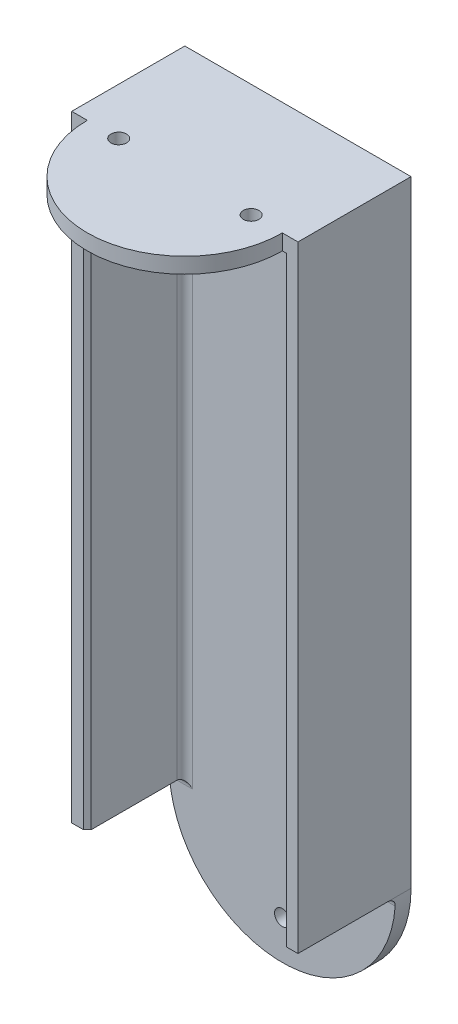
from build123d import *

# Parameters (mm, degrees)
ESQUISSE1_R             = 1
BOSS_EXTRU_2_DEPTH      = 2
ESQUISSE4_W             = 12.5
ESQUISSE4_H             = 79
BOSS_EXTRU_3_DEPTH      = 2
ESQUISSE6_W             = 12.5
ESQUISSE6_H             = 79
BOSS_EXTRU_4_DEPTH      = 2
BOSS_EXTRU_7_DEPTH      = 2
ESQUISSE14_R            = 1
ENL_V_MAT_EXTRU_4_DEPTH = 98.864702523
CHANFREIN3_SIZE         = 0.5
CONG_1_R                = 1


with BuildPart() as part:
    # Esquisse1 → Boss.-Extru.2 (new body)
    with BuildSketch(Plane.XY):
        with BuildLine():
            Line((14.5, -39.5), (14.5, 39.5))
            Line((14.5, 39.5), (-14.5, 39.5))
            Line((-14.5, 39.5), (-14.5, -39.5))
            ThreePointArc((-14.5, -39.5), (0, -54), (14.5, -39.5))
        make_face()
        with Locations((0, 34.5)):
            Circle(ESQUISSE1_R, mode=Mode.SUBTRACT)
        with Locations((0, -49)):
            Circle(ESQUISSE1_R, mode=Mode.SUBTRACT)
    extrude(amount=-BOSS_EXTRU_2_DEPTH)

    # Esquisse4 → Boss.-Extru.3 (add)
    with BuildSketch(Plane.ZY.offset(14.5)):
        with Locations((6.25, 0)):
            Rectangle(ESQUISSE4_W, ESQUISSE4_H)
    extrude(amount=-BOSS_EXTRU_3_DEPTH)

    # Esquisse6 → Boss.-Extru.4 (add)
    with BuildSketch(Plane(origin=(14.5, 0, 0), x_dir=(0, 0, -1), z_dir=(1, 0, 0))):
        with Locations((-6.25, 0)):
            Rectangle(ESQUISSE6_W, ESQUISSE6_H)
    extrude(amount=-BOSS_EXTRU_4_DEPTH)

    # Esquisse11 → Boss.-Extru.7 (add)
    with BuildSketch(Plane(origin=(0, 39.5, 0), x_dir=(1, 0, 0), z_dir=(0, 1, 0))):
        with BuildLine():
            Line((-12.5, 0), (12.5, 0))
            Line((12.5, 0), (12.5, -12.5))
            ThreePointArc((12.5, -12.5), (0, -25), (-12.5, -12.5))
            Line((-12.5, -12.5), (-12.5, 0))
        make_face()
    extrude(amount=-BOSS_EXTRU_7_DEPTH)

    # Esquisse14 → Enlèv. mat.-Extru.4 (cut, through all)
    with BuildSketch(Plane(origin=(0, 39.5, 0), x_dir=(1, 0, 0), z_dir=(0, 1, 0))):
        with Locations(Location((-8.474453363, -12.5, 0), (0, 0, 270))):
            Circle(ESQUISSE14_R)
        with Locations(Location((8.5, -12.5, 0), (0, 0, 270))):
            Circle(ESQUISSE14_R)
    extrude(amount=-ENL_V_MAT_EXTRU_4_DEPTH, mode=Mode.SUBTRACT)

    # Chanfrein3
    chanfrein3_edges = [part.edges().sort_by_distance(p)[0] for p in [
        (-12.5, -1, 12.5),
        (12.5, -1, 12.5),
    ]]
    chamfer(chanfrein3_edges, length=CHANFREIN3_SIZE)

    # Congé1
    # the kernel refuses this fillet: 1 mm, written as the material it adds along each edge
    with BuildSketch(Plane(origin=(-14.5, -39.5, 0), x_dir=(0, -1, 0), z_dir=(1, 0, 0))) as cong_1_piece_1_section:
        with BuildLine():
            CenterArc((CONG_1_R, -CONG_1_R), CONG_1_R, 90, 90)
            Line((0, -CONG_1_R), (-CONG_1_R * 0.02, -CONG_1_R))
            Line((-CONG_1_R * 0.02, -CONG_1_R), (-CONG_1_R * 0.02, CONG_1_R * 0.02))
            Line((-CONG_1_R * 0.02, CONG_1_R * 0.02), (CONG_1_R, CONG_1_R * 0.02))
            Line((CONG_1_R, CONG_1_R * 0.02), (CONG_1_R, 0))
        make_face()
    cong_1_piece_1 = extrude(amount=2, mode=Mode.PRIVATE)
    cong_1_piece_1 = cong_1_piece_1 & Plane(origin=(0, -39.5, 0.22667443), x_dir=(-1, 0, 0), z_dir=(0, 0, 1)) * Cylinder(14.5, 8, mode=Mode.PRIVATE)
    add(cong_1_piece_1)
    with BuildSketch(Plane(origin=(12.5, -39.5, 0), x_dir=(0, 0, 1), z_dir=(0, 1, 0)), Plane(origin=(-12.5, -39.5, 0), x_dir=(1, 0, 0), z_dir=(0, 1, 0))) as cong_1_piece_2:
        with BuildLine():
            CenterArc((CONG_1_R, -CONG_1_R), CONG_1_R, 90, 90)
            Line((0, -CONG_1_R), (-CONG_1_R * 0.02, -CONG_1_R))
            Line((-CONG_1_R * 0.02, -CONG_1_R), (-CONG_1_R * 0.02, CONG_1_R * 0.02))
            Line((-CONG_1_R * 0.02, CONG_1_R * 0.02), (CONG_1_R, CONG_1_R * 0.02))
            Line((CONG_1_R, CONG_1_R * 0.02), (CONG_1_R, 0))
        make_face()
    extrude(amount=77)
    with BuildSketch(Plane(origin=(14.5, -39.5, 0), x_dir=(0, 0, 1), z_dir=(-1, 0, 0))) as cong_1_piece_3_section:
        with BuildLine():
            CenterArc((CONG_1_R, -CONG_1_R), CONG_1_R, 90, 90)
            Line((0, -CONG_1_R), (-CONG_1_R * 0.02, -CONG_1_R))
            Line((-CONG_1_R * 0.02, -CONG_1_R), (-CONG_1_R * 0.02, CONG_1_R * 0.02))
            Line((-CONG_1_R * 0.02, CONG_1_R * 0.02), (CONG_1_R, CONG_1_R * 0.02))
            Line((CONG_1_R, CONG_1_R * 0.02), (CONG_1_R, 0))
        make_face()
    cong_1_piece_3 = extrude(amount=2, mode=Mode.PRIVATE)
    cong_1_piece_3 = cong_1_piece_3 & Plane(origin=(0, -39.5, 0.226674419), x_dir=(-1, 0, 0), z_dir=(0, 0, 1)) * Cylinder(14.5, 8, mode=Mode.PRIVATE)
    add(cong_1_piece_3)
    with BuildSketch(Plane(origin=(-12.5, 37.5, 0), x_dir=(0, 0, 1), z_dir=(1, 0, 0))) as cong_1_piece_4:
        with BuildLine():
            CenterArc((CONG_1_R, CONG_1_R), CONG_1_R, 180, 90)
            Line((0, CONG_1_R), (-CONG_1_R * 0.02, CONG_1_R))
            Line((-CONG_1_R * 0.02, CONG_1_R), (-CONG_1_R * 0.02, -CONG_1_R * 0.02))
            Line((-CONG_1_R * 0.02, -CONG_1_R * 0.02), (CONG_1_R, -CONG_1_R * 0.02))
            Line((CONG_1_R, -CONG_1_R * 0.02), (CONG_1_R, 0))
        make_face()
    extrude(amount=25)
    with BuildSketch(Plane(origin=(-14.5, -39.5, 0), x_dir=(0, -1, 0), z_dir=(1, 0, 0))) as cong_1_piece_5a_section:
        with BuildLine():
            CenterArc((CONG_1_R, -CONG_1_R), CONG_1_R, 90, 90)
            Line((0, -CONG_1_R), (-CONG_1_R * 0.02, -CONG_1_R))
            Line((-CONG_1_R * 0.02, -CONG_1_R), (-CONG_1_R * 0.02, CONG_1_R * 0.02))
            Line((-CONG_1_R * 0.02, CONG_1_R * 0.02), (CONG_1_R, CONG_1_R * 0.02))
            Line((CONG_1_R, CONG_1_R * 0.02), (CONG_1_R, 0))
        make_face()
    cong_1_piece_5a = extrude(amount=4.5, mode=Mode.PRIVATE)
    cong_1_piece_5a = split(cong_1_piece_5a, bisect_by=Plane(origin=(-12.5, -39.726395114, 0.226395114), z_dir=(1, 0, 0)), keep=Keep.TOP, mode=Mode.PRIVATE)
    with BuildSketch(Plane(origin=(-12.5, -42, 0), x_dir=(1, 0, 0), z_dir=(0, 1, 0))) as cong_1_piece_5b_section:
        with BuildLine():
            CenterArc((CONG_1_R, -CONG_1_R), CONG_1_R, 90, 90)
            Line((0, -CONG_1_R), (-CONG_1_R * 0.02, -CONG_1_R))
            Line((-CONG_1_R * 0.02, -CONG_1_R), (-CONG_1_R * 0.02, CONG_1_R * 0.02))
            Line((-CONG_1_R * 0.02, CONG_1_R * 0.02), (CONG_1_R, CONG_1_R * 0.02))
            Line((CONG_1_R, CONG_1_R * 0.02), (CONG_1_R, 0))
        make_face()
    cong_1_piece_5b = extrude(amount=79.5, mode=Mode.PRIVATE)
    cong_1_piece_5b = split(cong_1_piece_5b, bisect_by=Plane(origin=(-12.273604886, -39.5, 0.226395114), z_dir=(0, -1, 0)), keep=Keep.TOP, mode=Mode.PRIVATE)
    cong_1_piece_5 = cong_1_piece_5a & cong_1_piece_5b
    add(cong_1_piece_5)
    with BuildSketch(Plane(origin=(14.5, -39.5, 0), x_dir=(0, 0, 1), z_dir=(-1, 0, 0))) as cong_1_piece_6a_section:
        with BuildLine():
            CenterArc((CONG_1_R, -CONG_1_R), CONG_1_R, 90, 90)
            Line((0, -CONG_1_R), (-CONG_1_R * 0.02, -CONG_1_R))
            Line((-CONG_1_R * 0.02, -CONG_1_R), (-CONG_1_R * 0.02, CONG_1_R * 0.02))
            Line((-CONG_1_R * 0.02, CONG_1_R * 0.02), (CONG_1_R, CONG_1_R * 0.02))
            Line((CONG_1_R, CONG_1_R * 0.02), (CONG_1_R, 0))
        make_face()
    cong_1_piece_6a = extrude(amount=4.5, mode=Mode.PRIVATE)
    cong_1_piece_6a = split(cong_1_piece_6a, bisect_by=Plane(origin=(12.5, -39.726395114, 0.226395114), z_dir=(-1, 0, 0)), keep=Keep.TOP, mode=Mode.PRIVATE)
    with BuildSketch(Plane(origin=(12.5, -42, 0), x_dir=(0, 0, 1), z_dir=(0, 1, 0))) as cong_1_piece_6b_section:
        with BuildLine():
            CenterArc((CONG_1_R, -CONG_1_R), CONG_1_R, 90, 90)
            Line((0, -CONG_1_R), (-CONG_1_R * 0.02, -CONG_1_R))
            Line((-CONG_1_R * 0.02, -CONG_1_R), (-CONG_1_R * 0.02, CONG_1_R * 0.02))
            Line((-CONG_1_R * 0.02, CONG_1_R * 0.02), (CONG_1_R, CONG_1_R * 0.02))
            Line((CONG_1_R, CONG_1_R * 0.02), (CONG_1_R, 0))
        make_face()
    cong_1_piece_6b = extrude(amount=79.5, mode=Mode.PRIVATE)
    cong_1_piece_6b = split(cong_1_piece_6b, bisect_by=Plane(origin=(12.273604886, -39.5, 0.226395114), z_dir=(0, -1, 0)), keep=Keep.TOP, mode=Mode.PRIVATE)
    cong_1_piece_6 = cong_1_piece_6a & cong_1_piece_6b
    add(cong_1_piece_6)
    with BuildSketch(Plane(origin=(-12.5, 37.5, 0), x_dir=(0, 0, 1), z_dir=(1, 0, 0))) as cong_1_piece_7a_section:
        with BuildLine():
            CenterArc((CONG_1_R, CONG_1_R), CONG_1_R, 180, 90)
            Line((0, CONG_1_R), (-CONG_1_R * 0.02, CONG_1_R))
            Line((-CONG_1_R * 0.02, CONG_1_R), (-CONG_1_R * 0.02, -CONG_1_R * 0.02))
            Line((-CONG_1_R * 0.02, -CONG_1_R * 0.02), (CONG_1_R, -CONG_1_R * 0.02))
            Line((CONG_1_R, -CONG_1_R * 0.02), (CONG_1_R, 0))
        make_face()
    cong_1_piece_7a = extrude(amount=27.5, mode=Mode.PRIVATE)
    cong_1_piece_7a = split(cong_1_piece_7a, bisect_by=Plane(origin=(12.5, 37.273604886, 0.226395114), z_dir=(1, 0, 0)), keep=Keep.TOP, mode=Mode.PRIVATE)
    with BuildSketch(Plane(origin=(12.5, -39.5, 0), x_dir=(0, 0, 1), z_dir=(0, 1, 0))) as cong_1_piece_7b_section:
        with BuildLine():
            CenterArc((CONG_1_R, -CONG_1_R), CONG_1_R, 90, 90)
            Line((0, -CONG_1_R), (-CONG_1_R * 0.02, -CONG_1_R))
            Line((-CONG_1_R * 0.02, -CONG_1_R), (-CONG_1_R * 0.02, CONG_1_R * 0.02))
            Line((-CONG_1_R * 0.02, CONG_1_R * 0.02), (CONG_1_R, CONG_1_R * 0.02))
            Line((CONG_1_R, CONG_1_R * 0.02), (CONG_1_R, 0))
        make_face()
    cong_1_piece_7b = extrude(amount=79.5, mode=Mode.PRIVATE)
    cong_1_piece_7b = split(cong_1_piece_7b, bisect_by=Plane(origin=(12.273604886, 37.5, 0.226395114), z_dir=(0, 1, 0)), keep=Keep.TOP, mode=Mode.PRIVATE)
    cong_1_piece_7 = cong_1_piece_7a & cong_1_piece_7b
    add(cong_1_piece_7)
    with BuildSketch(Plane(origin=(-15, 37.5, 0), x_dir=(0, 0, 1), z_dir=(1, 0, 0))) as cong_1_piece_8a_section:
        with BuildLine():
            CenterArc((CONG_1_R, CONG_1_R), CONG_1_R, 180, 90)
            Line((0, CONG_1_R), (-CONG_1_R * 0.02, CONG_1_R))
            Line((-CONG_1_R * 0.02, CONG_1_R), (-CONG_1_R * 0.02, -CONG_1_R * 0.02))
            Line((-CONG_1_R * 0.02, -CONG_1_R * 0.02), (CONG_1_R, -CONG_1_R * 0.02))
            Line((CONG_1_R, -CONG_1_R * 0.02), (CONG_1_R, 0))
        make_face()
    cong_1_piece_8a = extrude(amount=27.5, mode=Mode.PRIVATE)
    cong_1_piece_8a = split(cong_1_piece_8a, bisect_by=Plane(origin=(-12.5, 37.273604886, 0.226395114), z_dir=(-1, 0, 0)), keep=Keep.TOP, mode=Mode.PRIVATE)
    with BuildSketch(Plane(origin=(-12.5, -39.5, 0), x_dir=(1, 0, 0), z_dir=(0, 1, 0))) as cong_1_piece_8b_section:
        with BuildLine():
            CenterArc((CONG_1_R, -CONG_1_R), CONG_1_R, 90, 90)
            Line((0, -CONG_1_R), (-CONG_1_R * 0.02, -CONG_1_R))
            Line((-CONG_1_R * 0.02, -CONG_1_R), (-CONG_1_R * 0.02, CONG_1_R * 0.02))
            Line((-CONG_1_R * 0.02, CONG_1_R * 0.02), (CONG_1_R, CONG_1_R * 0.02))
            Line((CONG_1_R, CONG_1_R * 0.02), (CONG_1_R, 0))
        make_face()
    cong_1_piece_8b = extrude(amount=79.5, mode=Mode.PRIVATE)
    cong_1_piece_8b = split(cong_1_piece_8b, bisect_by=Plane(origin=(-12.273604886, 37.5, 0.226395114), z_dir=(0, 1, 0)), keep=Keep.TOP, mode=Mode.PRIVATE)
    cong_1_piece_8 = cong_1_piece_8a & cong_1_piece_8b
    add(cong_1_piece_8)


solid = part.part
